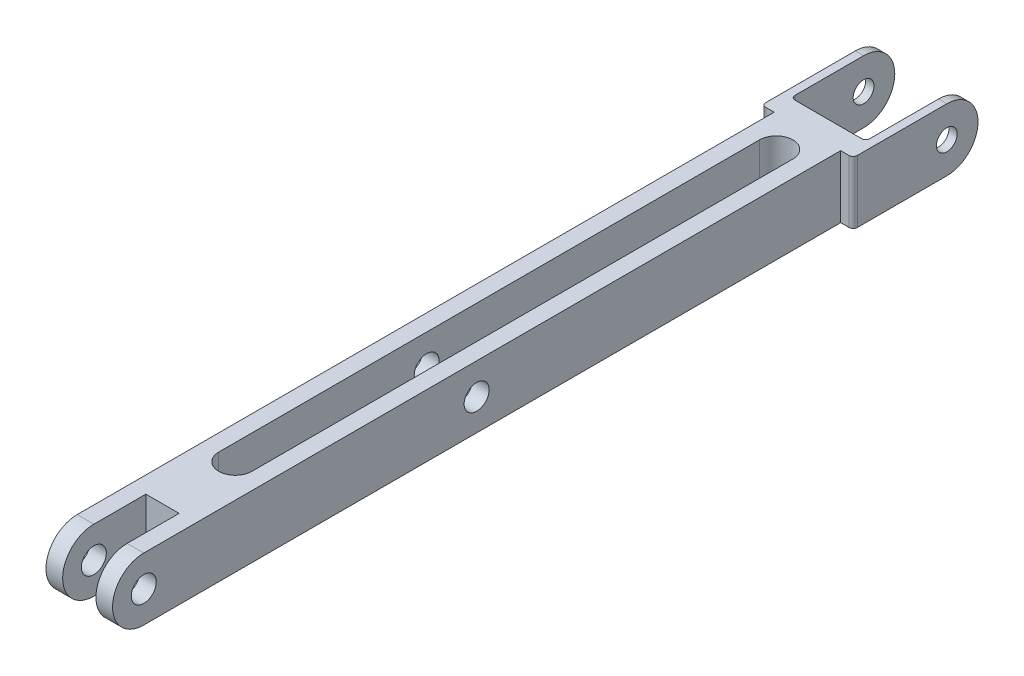
from build123d import *

# Parameters (mm, degrees)
EXTRUDE_1_DEPTH     = 16
SKETCH_3_W          = 8
SKETCH_3_H          = 20
SKETCH_3_H_2        = 25
CUT_EXTRUDE_1_DEPTH = 105.820083953
SKETCH_4_R          = 3
SKETCH_4_R_2        = 6
CUT_EXTRUDE_2_DEPTH = 105.012018536
CUT_EXTRUDE_3_DEPTH = 105.820083953
SKETCH_6_R          = 3
CUT_EXTRUDE_4_DEPTH = 105.012018536
EXTRUDE_2_DEPTH     = 15
CUT_EXTRUDE_START   = -15
CUT_EXTRUDE_5_DEPTH = 15
FILLET_1_R          = 7.5
SKETCH_9_R          = 2.5
CUT_EXTRUDE_6_DEPTH = 106.102331087


with BuildPart() as part:
    # 草图2 → 凸台-拉伸1 (new body)
    with BuildSketch(Plane(origin=(0, 0, 0), x_dir=(0, 0, -1), z_dir=(1, 0, 0))):
        with BuildLine():
            Line((-95, -7.5), (95, -7.5))
            ThreePointArc((95, -7.5), (102.5, 0), (95, 7.5))
            Line((95, 7.5), (-95, 7.5))
            ThreePointArc((-95, 7.5), (-102.5, 0), (-95, -7.5))
        make_face()
    extrude(amount=EXTRUDE_1_DEPTH)

    # 草图3 → 切除-拉伸1 (cut, through all)
    with BuildSketch(Plane(origin=(0, 7.5, 0), x_dir=(1, 0, 0), z_dir=(0, 1, 0))):
        with Locations((8, -92.5)):
            Rectangle(SKETCH_3_W, SKETCH_3_H)
        with Locations((8, 90)):
            Rectangle(SKETCH_3_W, SKETCH_3_H_2)
    extrude(amount=-CUT_EXTRUDE_1_DEPTH, mode=Mode.SUBTRACT)

    # 草图4 → 切除-拉伸2 (cut, through all)
    with BuildSketch(Plane(origin=(16, 0, 0), x_dir=(0, 0, -1), z_dir=(1, 0, 0))):
        with Locations((-95, 0)):
            Circle(SKETCH_4_R)
        with Locations((95, 0)):
            Circle(SKETCH_4_R_2)
    extrude(amount=-CUT_EXTRUDE_2_DEPTH, mode=Mode.SUBTRACT)

    # 草图5 → 切除-拉伸3 (cut, through all)
    with BuildSketch(Plane.XZ.offset(7.5)):
        with BuildLine():
            Line((12, 65), (12, -65))
            ThreePointArc((12, -65), (8, -69), (4, -65))
            Line((4, -65), (4, 65))
            ThreePointArc((4, 65), (8, 69), (12, 65))
        make_face()
    extrude(amount=-CUT_EXTRUDE_3_DEPTH, mode=Mode.SUBTRACT)

    # 草图6 → 切除-拉伸4 (cut, through all)
    with BuildSketch(Plane.ZY):
        with Locations((15, 0)):
            Circle(SKETCH_6_R)
    extrude(amount=-CUT_EXTRUDE_4_DEPTH, mode=Mode.SUBTRACT)

    # 草图7 → 凸台-拉伸2 (add)
    with BuildSketch(Plane.XZ.offset(7.5)):
        with BuildLine():
            Line((7.022963208, -77.5), (0, -77.5))
            ThreePointArc((0, -77.5), (-0.707106781, -77.792893219), (-1, -78.5))
            Line((-1, -78.5), (-1, -102.5))
            Line((-1, -102.5), (-3, -102.5))
            Line((-3, -102.5), (-3, -73.5))
            ThreePointArc((-3, -73.5), (-2.707106781, -72.792893219), (-2, -72.5))
            Line((-2, -72.5), (0, -72.5))
            Line((0, -72.5), (0, -76.537771908))
            Line((0, -76.537771908), (16, -76.537771908))
            Line((16, -76.537771908), (16, -72.5))
            Line((16, -72.5), (18, -72.5))
            ThreePointArc((18, -72.5), (18.707106781, -72.792893219), (19, -73.5))
            Line((19, -73.5), (19, -102.5))
            Line((19, -102.5), (17, -102.5))
            Line((17, -102.5), (17, -78.5))
            ThreePointArc((17, -78.5), (16.707106781, -77.792893219), (16, -77.5))
            Line((16, -77.5), (8.977036792, -77.5))
            Line((8.977036792, -77.5), (7.022963208, -77.5))
        make_face()
    extrude(amount=-EXTRUDE_2_DEPTH)

    # 草图8 → 切除-拉伸5 (cut)
    with BuildSketch(Plane(origin=(0, -7.5, 0), x_dir=(-1, 0, 0), z_dir=(0, -1, 0)).offset(CUT_EXTRUDE_START)):
        with BuildLine():
            Line((-17, 102.5), (1, 102.5))
            Line((1, 102.5), (1, 78.5))
            ThreePointArc((1, 78.5), (0.707106781, 77.792893219), (0, 77.5))
            Line((0, 77.5), (-16, 77.5))
            ThreePointArc((-16, 77.5), (-16.707106781, 77.792893219), (-17, 78.5))
            Line((-17, 78.5), (-17, 102.5))
        make_face()
    extrude(amount=CUT_EXTRUDE_5_DEPTH, mode=Mode.SUBTRACT)

    # 圆角1
    fillet_1_edges = [part.edges().sort_by_distance(p)[0] for p in [
        (18, 7.5, -102.5),
        (18, -7.5, -102.5),
        (-2, 7.5, -102.5),
        (-2, -7.5, -102.5),
    ]]
    fillet(fillet_1_edges, radius=FILLET_1_R - 0.0001)  # a hair under: the kernel refuses the full size

    # 草图9 → 切除-拉伸6 (cut, through all)
    with BuildSketch(Plane(origin=(19, 0, 0), x_dir=(0, 0, -1), z_dir=(1, 0, 0))):
        with Locations((95, 0)):
            Circle(SKETCH_9_R)
    extrude(amount=-CUT_EXTRUDE_6_DEPTH, mode=Mode.SUBTRACT)


solid = part.part
